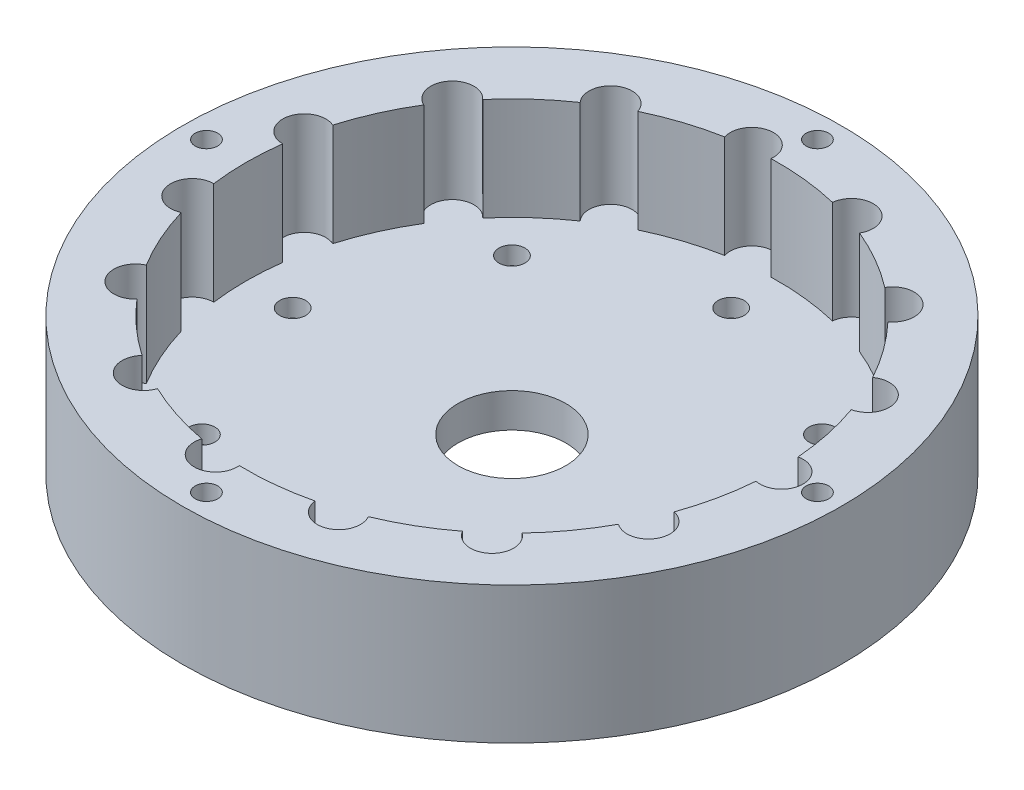
from build123d import *

# Parameters (mm, degrees)
SKETCH1_R           = 45.85
SKETCH1_R_2         = 1.5635
SKETCH1_R_3         = 7.5
BOSS_EXTRUDE1_DEPTH = 4.7625
SKETCH1_6_R         = 1.8125
CUT_EXTRUDE1_DEPTH  = 2.5
BOSS_EXTRUDE2_START = 14.2875
SKETCH1_7_R         = 45.85
SKETCH1_7_R_2       = 1.5635
BOSS_EXTRUDE2_DEPTH = 14.2875


with BuildPart() as part:
    # Sketch1 → Boss-Extrude1 (new body)
    with BuildSketch(Plane(origin=(0, 0, 0), x_dir=(1, 0, 0), z_dir=(0, 1, 0))):
        Circle(SKETCH1_R)
        with Locations((0, -42.5)):
            Circle(SKETCH1_R_2, mode=Mode.SUBTRACT)
        with Locations((-42.5, 0)):
            Circle(SKETCH1_R_2, mode=Mode.SUBTRACT)
        with Locations((42.5, 0)):
            Circle(SKETCH1_R_2, mode=Mode.SUBTRACT)
        with Locations((0, 42.5)):
            Circle(SKETCH1_R_2, mode=Mode.SUBTRACT)
        Circle(SKETCH1_R_3, mode=Mode.SUBTRACT)
    extrude(amount=-BOSS_EXTRUDE1_DEPTH)

    # Sketch1<6> → Cut-Extrude1 (cut)
    with BuildSketch(Plane(origin=(0, 0, 0), x_dir=(1, 0, 0), z_dir=(0, 1, 0))):
        with Locations((30.5, 0)):
            Circle(SKETCH1_6_R)
        with Locations((21.566756826, -21.566756826)):
            Circle(SKETCH1_6_R)
        with Locations((0, -30.5)):
            Circle(SKETCH1_6_R)
        with Locations((-21.566756826, -21.566756826)):
            Circle(SKETCH1_6_R)
        with Locations((-30.5, 0)):
            Circle(SKETCH1_6_R)
        with Locations((-21.566756826, 21.566756826)):
            Circle(SKETCH1_6_R)
        with Locations((0, 30.5)):
            Circle(SKETCH1_6_R)
        with Locations((21.566756826, 21.566756826)):
            Circle(SKETCH1_6_R)
    extrude(amount=-CUT_EXTRUDE1_DEPTH, mode=Mode.SUBTRACT)

    # Sketch1<7> → Boss-Extrude2 (add)
    with BuildSketch(Plane(origin=(0, 0, 0), x_dir=(1, 0, 0), z_dir=(0, 1, 0)).offset(BOSS_EXTRUDE2_START)):
        Circle(SKETCH1_7_R)
        with Locations((0, -42.5)):
            Circle(SKETCH1_7_R_2, mode=Mode.SUBTRACT)
        with Locations((-42.5, 0)):
            Circle(SKETCH1_7_R_2, mode=Mode.SUBTRACT)
        with Locations((42.5, 0)):
            Circle(SKETCH1_7_R_2, mode=Mode.SUBTRACT)
        with BuildLine():
            ThreePointArc((36.883333333, 2.935936345), (39.39076704, 2.32916294), (40.5, 0))
            ThreePointArc((40.5, 0), (39.39076704, -2.32916294), (36.883333333, -2.935936345))
            ThreePointArc((36.883333333, -2.935936345), (36.191461227, -7.69273256), (34.888754523, -12.319691873))
            ThreePointArc((34.888754523, -12.319691873), (36.59166411, -13.367471546), (37.257954662, -15.252624115))
            ThreePointArc((37.257954662, -15.252624115), (35.6231437, -17.924001829), (32.500448736, -17.683914497))
            ThreePointArc((32.500448736, -17.683914497), (29.933628792, -21.748054335), (26.861593101, -25.445133446))
            ThreePointArc((26.861593101, -25.445133446), (27.767055295, -26.50917897), (28.092397738, -27.867930955))
            ThreePointArc((28.092397738, -27.867930955), (25.872343464, -30.764771418), (22.497941295, -29.37418318))
            ThreePointArc((22.497941295, -29.37418318), (18.5, -32.04293994), (14.189818202, -34.170880284))
            ThreePointArc((14.189818202, -34.170880284), (14.486847583, -34.891651942), (14.588137289, -35.664619361))
            ThreePointArc((14.588137289, -35.664619361), (11.748752331, -38.660316744), (8.605335417, -35.985388734))
            ThreePointArc((8.605335417, -35.985388734), (3.867553141, -36.797310129), (-0.935505175, -36.988171489))
            ThreePointArc((-0.935505175, -36.988171489), (-0.92374189, -37.141170608), (-0.919817373, -37.294571076))
            ThreePointArc((-0.919817373, -37.294571076), (-4.385552663, -40.258199029), (-6.775211132, -36.37439366))
            ThreePointArc((-6.775211132, -36.37439366), (-11.433628792, -35.189091103), (-15.899071208, -33.409871815))
            ThreePointArc((-15.899071208, -33.409871815), (-20.25, -35.074028853), (-20.984262125, -30.47393547))
            ThreePointArc((-20.984262125, -30.47393547), (-24.757832435, -27.496358543), (-28.113543391, -24.054701786))
            ThreePointArc((-28.113543391, -24.054701786), (-32.765188272, -23.805302718), (-31.564943561, -19.304256991))
            ThreePointArc((-31.564943561, -19.304256991), (-33.801181933, -15.049255794), (-35.466928517, -10.540255288))
            ThreePointArc((-35.466928517, -10.540255288), (-39.61497783, -8.420423478), (-36.687759497, -4.796697105))
            ThreePointArc((-36.687759497, -4.796697105), (-37, 0), (-36.687759497, 4.796697105))
            ThreePointArc((-36.687759497, 4.796697105), (-39.61497783, 8.420423478), (-35.466928517, 10.540255288))
            ThreePointArc((-35.466928517, 10.540255288), (-33.801181933, 15.049255794), (-31.564943561, 19.304256991))
            ThreePointArc((-31.564943561, 19.304256991), (-32.765188272, 23.805302718), (-28.113543391, 24.054701786))
            ThreePointArc((-28.113543391, 24.054701786), (-24.757832435, 27.496358543), (-20.984262125, 30.47393547))
            ThreePointArc((-20.984262125, 30.47393547), (-20.25, 35.074028853), (-15.899071208, 33.409871815))
            ThreePointArc((-15.899071208, 33.409871815), (-11.433628792, 35.189091103), (-6.775211132, 36.37439366))
            ThreePointArc((-6.775211132, 36.37439366), (-4.385552663, 40.258199029), (-0.919817373, 37.294571076))
            ThreePointArc((-0.919817373, 37.294571076), (-0.92374189, 37.141170608), (-0.935505175, 36.988171489))
            ThreePointArc((-0.935505175, 36.988171489), (3.867553141, 36.797310129), (8.605335417, 35.985388734))
            ThreePointArc((8.605335417, 35.985388734), (11.748752331, 38.660316744), (14.588137289, 35.664619361))
            ThreePointArc((14.588137289, 35.664619361), (14.486847583, 34.891651942), (14.189818202, 34.170880284))
            ThreePointArc((14.189818202, 34.170880284), (18.5, 32.04293994), (22.497941295, 29.37418318))
            ThreePointArc((22.497941295, 29.37418318), (25.872343464, 30.764771418), (28.092397738, 27.867930955))
            ThreePointArc((28.092397738, 27.867930955), (27.767055295, 26.50917897), (26.861593101, 25.445133446))
            ThreePointArc((26.861593101, 25.445133446), (29.933628792, 21.748054335), (32.500448736, 17.683914497))
            ThreePointArc((32.500448736, 17.683914497), (35.6231437, 17.924001829), (37.257954662, 15.252624115))
            ThreePointArc((37.257954662, 15.252624115), (36.59166411, 13.367471546), (34.888754523, 12.319691873))
            ThreePointArc((34.888754523, 12.319691873), (36.191461227, 7.69273256), (36.883333333, 2.935936345))
        make_face(mode=Mode.SUBTRACT)
        with Locations((0, 42.5)):
            Circle(SKETCH1_7_R_2, mode=Mode.SUBTRACT)
    extrude(amount=-BOSS_EXTRUDE2_DEPTH)


solid = part.part
